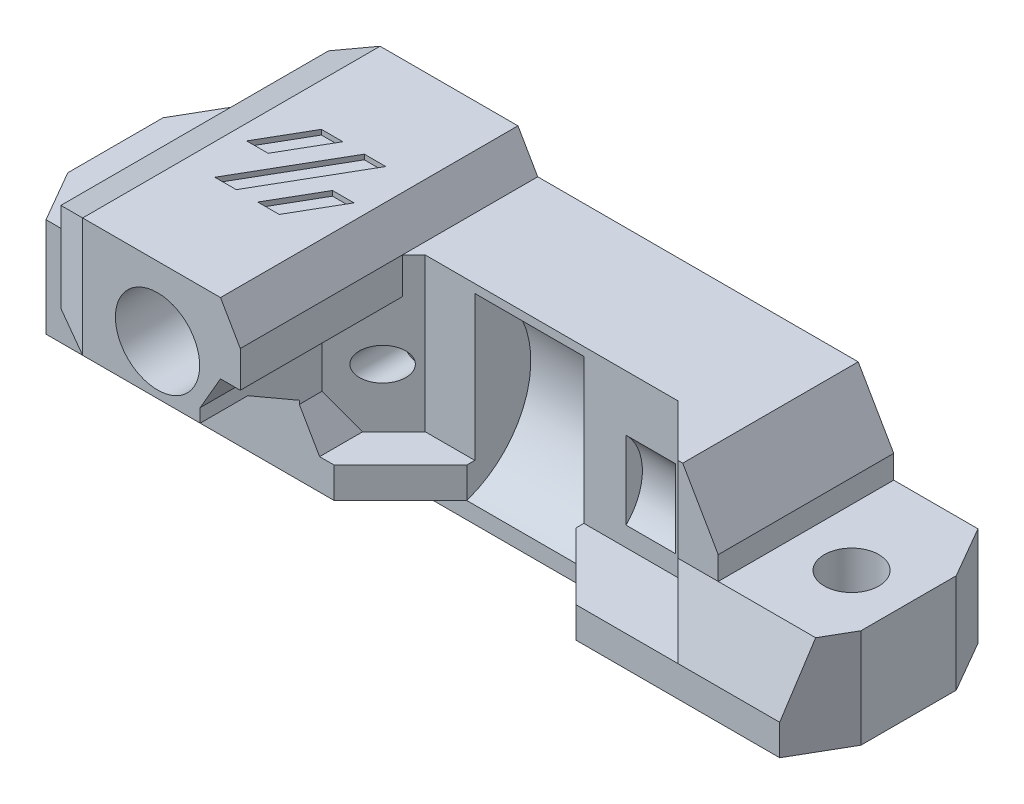
from build123d import *
from OCP.BRepFilletAPI import BRepFilletAPI_MakeChamfer

# Parameters (mm, degrees)
AUFSATZ_LINEAR_AUSTRAGEN1_DEPTH       = 80
SKIZZE2_R                             = 4.25
SCHNITT_LINEAR_AUSTRAGEN1_DEPTH       = 30
SKIZZE3_R                             = 1.65
SCHNITT_LINEAR_AUSTRAGEN2_DEPTH       = 17.5
SKIZZE4_R                             = 1.65
SCHNITT_LINEAR_AUSTRAGEN3_DEPTH       = 30
SCHNITT_LINEAR_START                  = -22
SKIZZE5_R                             = 2.75
SCHNITT_LINEAR_AUSTRAGEN4_DEPTH       = 22
SKIZZE6_R                             = 2.75
SCHNITT_LINEAR_AUSTRAGEN5_DEPTH       = 10
SCHNITT_LINEAR_AUSTRAGEN6_DEPTH       = 9.5
SCHNITT_LINEAR_START_2                = -12.5
SKIZZE8_W                             = 11.5
SKIZZE8_H                             = 12
SCHNITT_LINEAR_AUSTRAGEN7_DEPTH       = 30
SCHNITT_LINEAR_START_3                = 10.2
SKIZZE9_R                             = 9.5
SCHNITT_LINEAR_AUSTRAGEN8_DEPTH       = 11
SCHNITT_LINEAR_START_4                = 25.45
SKIZZE10_R                            = 5.5
SCHNITT_LINEAR_AUSTRAGEN9_DEPTH       = 5
AUFSATZ_LINEAR_START                  = -18.545259589
AUFSATZ_LINEAR_AUSTRAGEN2_DEPTH       = 15.445259589
SCHNITT_LINEAR_START_5                = -20.5
SKIZZE12_R                            = 1.65
SCHNITT_LINEAR_AUSTRAGEN10_DEPTH      = 20.5
FASE1_SIZE                            = 1.6
SKIZZE15_W                            = 20
SKIZZE15_H                            = 10
SCHNITT_LINEAR_AUSTRAGEN12_DEPTH      = 80
SCHNITT_LINEAR_START_6                = -15.44526
SCHNITT_LINEAR_AUSTRAGEN13_DEPTH      = 15.44526
SCHNITT_LINEAR_START_7                = -3.1
SKIZZE17_W                            = 49.404551733
SKIZZE17_H                            = 10
SCHNITT_LINEAR_AUSTRAGEN14_DEPTH      = 3.1
SCHNITT_LINEAR_AUSTRAGEN17_DEPTH      = 11
AUFSATZ_LINEAR_AUSTRAGEN3_REACH       = 87.346
SKIZZE21_W                            = 10
SKIZZE21_H                            = 10
SCHNITT_LINEAR_AUSTRAGEN18_DEPTH      = 30.595448267
SCHNITT_LINEAR_AUSTRAGEN19_REACH      = 76.674
SCHNITT_LINEAR_AUSTRAGEN19_END_RADIUS = 4.25
SKIZZE22_R                            = 2.25
SKIZZE23_R                            = 3
SCHNITT_LINEAR_AUSTRAGEN20_DEPTH      = 4
FASE2_SIZE                            = 3
FASE2_SIZE2                           = 5.196152423
AUFSATZ_LINEAR_START_2                = -17
AUFSATZ_LINEAR_AUSTRAGEN4_DEPTH       = 46
FASE3_SIZE                            = 3
FASE3_SIZE2                           = 5.196152423
FASE4_SIZE                            = 3
FASE4_SIZE2                           = 5.196152423
SCHNITT_LINEAR_AUSTRAGEN23_DEPTH      = 3.1
SCHNITT_LINEAR_AUSTRAGEN22_DEPTH      = 0.5
K_RPER_VERSCHIEBEN_KOPIEREN1_ANGLE    = 90


# Read off the part's stored shape, not the designer's step: Aufsatz-Linear austragen2, Schnitt-Linear austragen17
with BuildPart() as part:
    # Skizze1 → Aufsatz-Linear austragen1 (new body)
    with BuildSketch(Plane(origin=(0, 0, 0), x_dir=(0, 0, -1), z_dir=(1, 0, 0))):
        Polygon((0, 0), (0, 20), (-22, 20), (-22, -10), (20, -10), (20, 0), align=None)
    extrude(amount=AUFSATZ_LINEAR_AUSTRAGEN1_DEPTH)

    # Skizze2 → Schnitt-Linear austragen1 (cut)
    with BuildSketch(Plane(origin=(0, 20, 0), x_dir=(1, 0, 0), z_dir=(0, 1, 0))):
        with Locations(Location((55.75, -15, 0), (0, 0, 270))):
            Circle(SKIZZE2_R)
    extrude(amount=-SCHNITT_LINEAR_AUSTRAGEN1_DEPTH, mode=Mode.SUBTRACT)

    # Skizze3 → Schnitt-Linear austragen2 (cut)
    with BuildSketch(Plane.XZ.offset(10)):
        Polygon((49.399147039, 22), (47.404551733, 18.545259589), (47.404551733, 14.9), (49.404551733, 14.9), (51.45, 11.357179677), (51.45, 6.642820323), (49.404551733, 3.1), (17.595448267, 3.1), (15.55, 6.642820323), (15.55, 11.357179677), (17.595448267, 14.9), (19.595448267, 14.9), (19.595448267, 18.545259589), (0, 18.545259589), (0, 22), align=None)
        with Locations(Location((48.4, 9, 0), (0, 0, 270))):
            Circle(SKIZZE3_R, mode=Mode.SUBTRACT)
        with Locations(Location((18.6, 9, 0), (0, 0, 270))):
            Circle(SKIZZE3_R, mode=Mode.SUBTRACT)
    extrude(amount=-SCHNITT_LINEAR_AUSTRAGEN2_DEPTH, mode=Mode.SUBTRACT)

    # Skizze4 → Schnitt-Linear austragen3 (cut)
    with BuildSketch(Plane.XZ.offset(10)):
        with Locations(Location((18.6, 9, 0), (0, 0, 270))):
            Circle(SKIZZE4_R)
        with Locations(Location((48.4, 9, 0), (0, 0, 270))):
            Circle(SKIZZE4_R)
    extrude(amount=-SCHNITT_LINEAR_AUSTRAGEN3_DEPTH, mode=Mode.SUBTRACT)

    # Skizze5 → Schnitt-Linear austragen4 (cut)
    with BuildSketch(Plane(origin=(0, 0, 0), x_dir=(-1, 0, 0), z_dir=(0, 0, -1)).offset(SCHNITT_LINEAR_START)):
        with Locations((-5.75, 10)):
            Circle(SKIZZE5_R)
        with Locations((-74.25, 10)):
            Circle(SKIZZE5_R)
    extrude(amount=SCHNITT_LINEAR_AUSTRAGEN4_DEPTH, mode=Mode.SUBTRACT)

    # Skizze6 → Schnitt-Linear austragen5 (cut)
    with BuildSketch(Plane(origin=(0, 0, 0), x_dir=(1, 0, 0), z_dir=(0, 1, 0))):
        with Locations(Location((40, 10, 0), (0, 0, 270))):
            Circle(SKIZZE6_R)
    extrude(amount=-SCHNITT_LINEAR_AUSTRAGEN5_DEPTH, mode=Mode.SUBTRACT)

    # Skizze7 → Schnitt-Linear austragen6 (cut)
    with BuildSketch(Plane(origin=(0, 20, 0), x_dir=(1, 0, 0), z_dir=(0, 1, 0))):
        Polygon((21.890896534, -9), (20.245448267, -6.15), (16.954551733, -6.15), (15.309103466, -9), (16.954551733, -11.85), (20.245448267, -11.85), align=None)
        Polygon((51.690896534, -9), (50.045448267, -6.15), (46.754551733, -6.15), (45.109103466, -9), (46.754551733, -11.85), (50.045448267, -11.85), align=None)
    extrude(amount=-SCHNITT_LINEAR_AUSTRAGEN6_DEPTH, mode=Mode.SUBTRACT)

    # Skizze8 → Schnitt-Linear austragen7 (cut)
    with BuildSketch(Plane.XZ.offset(-7.5).offset(SCHNITT_LINEAR_START_2)):
        Polygon((49.399147039, 22), (47.404551733, 18.545259589), (15.081237719, 18.545259589), (11.5, 12.342373906), (11.5, 10), (0, 10), (0, 22), align=None)
        with Locations((74.25, 16)):
            Rectangle(SKIZZE8_W, SKIZZE8_H)
    extrude(amount=SCHNITT_LINEAR_AUSTRAGEN7_DEPTH, mode=Mode.SUBTRACT)

    # Skizze9 → Schnitt-Linear austragen8 (cut)
    with BuildSketch(Plane.ZY.offset(-51.45).offset(SCHNITT_LINEAR_START_3)):
        with Locations((9, 3.65)):
            Circle(SKIZZE9_R)
    extrude(amount=SCHNITT_LINEAR_AUSTRAGEN8_DEPTH, mode=Mode.SUBTRACT)

    # Skizze10 → Schnitt-Linear austragen9 (cut)
    with BuildSketch(Plane.ZY.offset(-51.45).offset(SCHNITT_LINEAR_START_4)):
        with Locations((9, 3.65)):
            Circle(SKIZZE10_R)
    extrude(amount=SCHNITT_LINEAR_AUSTRAGEN9_DEPTH, mode=Mode.SUBTRACT)

    # Aufsatz-Linear austragen2 outline → Aufsatz-Linear austragen2 (add)
    with BuildSketch(Plane(origin=(0, 0, 0), x_dir=(-1, 0, 0), z_dir=(0, 0, -1)).offset(AUFSATZ_LINEAR_START)):
        Polygon((-46.25, 7.5), (-51.45, 7.5), (-51.45, 2.3), align=None)
        Polygon((-15.55, 7.5), (-20.75, 7.5), (-15.55, 2.3), align=None)
    extrude(amount=AUFSATZ_LINEAR_AUSTRAGEN2_DEPTH)

    # Skizze12 → Schnitt-Linear austragen10 (cut)
    with BuildSketch(Plane(origin=(0, 10.5, 0), x_dir=(1, 0, 0), z_dir=(0, 1, 0)).offset(SCHNITT_LINEAR_START_5)):
        with Locations(Location((18.6, -9, 0), (0, 0, 90))):
            Circle(SKIZZE12_R)
        with Locations(Location((48.4, -9, 0), (0, 0, 90))):
            Circle(SKIZZE12_R)
    extrude(amount=SCHNITT_LINEAR_AUSTRAGEN10_DEPTH, mode=Mode.SUBTRACT)

    # Fase1
    # the kernel refuses this chamfer: 1.6 mm, written as the material it takes off along each edge
    with BuildSketch(Plane(origin=(18.6, 10.5, 9), x_dir=(0, 0, -1), z_dir=(-1, 0, 0))) as fase1_piece_1_section:
        Polygon((1.65 + FASE1_SIZE, 0), (1.65, FASE1_SIZE), (1.65, 0), align=None)
    fase1_piece_1 = revolve(axis=Axis((18.6, 10.5, 9), (0, -1, 0)), mode=Mode.PRIVATE)
    fase1_piece_1 = split(fase1_piece_1, bisect_by=Plane(origin=(20.016275588, 9.716390068, 12.246938724), z_dir=(-0.8660254037844389, 0, -0.4999999999999995)), keep=Keep.TOP, mode=Mode.PRIVATE)
    fase1_piece_1 = split(fase1_piece_1, bisect_by=Plane(origin=(18.6, 9.716390068, 11.85), z_dir=(0, 0, -1)), keep=Keep.TOP, mode=Mode.PRIVATE)
    fase1_piece_1 = split(fase1_piece_1, bisect_by=Plane(origin=(22.120069214, 9.716390068, 9.396938724), z_dir=(-0.8660254037844397, 0, 0.4999999999999981)), keep=Keep.TOP, mode=Mode.PRIVATE)
    fase1_piece_1 = split(fase1_piece_1, bisect_by=Plane(origin=(17.183724412, 9.716390068, 12.246938724), z_dir=(0.8660254037844387, 0, -0.4999999999999999)), keep=Keep.TOP, mode=Mode.PRIVATE)
    fase1_piece_1 = split(fase1_piece_1, bisect_by=Plane(origin=(18.6, 9.716390068, 6.15), z_dir=(0, 0, 1)), keep=Keep.TOP, mode=Mode.PRIVATE)
    fase1_piece_1 = split(fase1_piece_1, bisect_by=Plane(origin=(15.079930786, 9.716390068, 9.396938724), z_dir=(0.8660254037844385, 0, 0.5000000000000003)), keep=Keep.TOP, mode=Mode.PRIVATE)
    add(fase1_piece_1, mode=Mode.SUBTRACT)
    with BuildSketch(Plane(origin=(48.4, 10.5, 9), x_dir=(0, 0, -1), z_dir=(-1, 0, 0))) as fase1_piece_2_section:
        Polygon((1.65 + FASE1_SIZE, 0), (1.65, FASE1_SIZE), (1.65, 0), align=None)
    fase1_piece_2 = revolve(axis=Axis((48.4, 10.5, 9), (0, -1, 0)), mode=Mode.PRIVATE)
    fase1_piece_2 = split(fase1_piece_2, bisect_by=Plane(origin=(49.816275588, 9.716390068, 12.246938724), z_dir=(-0.8660254037844392, 0, -0.4999999999999991)), keep=Keep.TOP, mode=Mode.PRIVATE)
    fase1_piece_2 = split(fase1_piece_2, bisect_by=Plane(origin=(48.4, 9.716390068, 11.85), z_dir=(0, 0, -1)), keep=Keep.TOP, mode=Mode.PRIVATE)
    fase1_piece_2 = split(fase1_piece_2, bisect_by=Plane(origin=(51.920069214, 9.716390068, 9.396938724), z_dir=(-0.8660254037844392, 0, 0.49999999999999917)), keep=Keep.TOP, mode=Mode.PRIVATE)
    fase1_piece_2 = split(fase1_piece_2, bisect_by=Plane(origin=(46.983724412, 9.716390068, 12.246938724), z_dir=(0.8660254037844384, 0, -0.5000000000000006)), keep=Keep.TOP, mode=Mode.PRIVATE)
    fase1_piece_2 = split(fase1_piece_2, bisect_by=Plane(origin=(48.4, 9.716390068, 6.15), z_dir=(0, 0, 1)), keep=Keep.TOP, mode=Mode.PRIVATE)
    fase1_piece_2 = split(fase1_piece_2, bisect_by=Plane(origin=(44.879930786, 9.716390068, 9.396938724), z_dir=(0.8660254037844386, 0, 0.5000000000000001)), keep=Keep.TOP, mode=Mode.PRIVATE)
    add(fase1_piece_2, mode=Mode.SUBTRACT)

    # Skizze15 → Schnitt-Linear austragen12 (cut)
    with BuildSketch(Plane(origin=(80, 0, 0), x_dir=(0, 0, -1), z_dir=(1, 0, 0))):
        with Locations((10, -5)):
            Rectangle(SKIZZE15_W, SKIZZE15_H)
    extrude(amount=-SCHNITT_LINEAR_AUSTRAGEN12_DEPTH, mode=Mode.SUBTRACT)

    # Skizze16 → Schnitt-Linear austragen13 (cut)
    with BuildSketch(Plane.XY.offset(18.545259589).offset(SCHNITT_LINEAR_START_6)):
        Polygon((0, -10), (0, 2.3), (15.55, 2.3), (19.595448267, 6.345448267), (19.595448267, -10), align=None)
    extrude(amount=SCHNITT_LINEAR_AUSTRAGEN13_DEPTH, mode=Mode.SUBTRACT)

    # Skizze17 → Schnitt-Linear austragen14 (cut)
    with BuildSketch(Plane.XY.offset(3.1).offset(SCHNITT_LINEAR_START_7)):
        with Locations((24.702275867, -5)):
            Rectangle(SKIZZE17_W, SKIZZE17_H)
    extrude(amount=SCHNITT_LINEAR_AUSTRAGEN14_DEPTH, mode=Mode.SUBTRACT)

    # Schnitt-Linear austragen17 outline → Schnitt-Linear austragen17 (cut)
    with BuildSketch(Plane(origin=(30.25, 0, 0), x_dir=(0, 0, -1), z_dir=(1, 0, 0))):
        with BuildLine():
            ThreePointArc((0, 0.608618735), (-0.109374334, 0.302347799), (-0.229167656, 0))
            Line((-0.229167656, 0), (0, 0))
            Line((0, 0), (0, 0.608618735))
        make_face()
    extrude(amount=SCHNITT_LINEAR_AUSTRAGEN17_DEPTH, mode=Mode.SUBTRACT)

    # Aufsatz-Linear austragen3: up to this plane
    aufsatz_linear_austragen3_end = Plane(origin=(-0.5159461, -13.7659461, 25.899170114), z_dir=(0.707106781186543, -0.707106781186552, 0))
    # Skizze20 → Aufsatz-Linear austragen3 (add, up to the surface)
    with BuildSketch(Plane.ZY, mode=Mode.PRIVATE) as aufsatz_linear_austragen3_sk1:
        Polygon((10, 2.3), (3.1, 2.3), (3.1, 0), align=None)
    aufsatz_linear_austragen3_tool1 = split(extrude(aufsatz_linear_austragen3_sk1.sketch, amount=-AUFSATZ_LINEAR_AUSTRAGEN3_REACH, mode=Mode.PRIVATE), bisect_by=aufsatz_linear_austragen3_end, keep=Keep.BOTH, mode=Mode.PRIVATE)
    add(aufsatz_linear_austragen3_tool1.solids().sort_by_distance((0, 1.533333, 5.4))[0])

    # Skizze21 → Schnitt-Linear austragen18 (cut)
    with BuildSketch(Plane(origin=(80, 0, 0), x_dir=(0, 0, -1), z_dir=(1, 0, 0))):
        with Locations((-5, -5)):
            Rectangle(SKIZZE21_W, SKIZZE21_H)
    extrude(amount=-SCHNITT_LINEAR_AUSTRAGEN18_DEPTH, mode=Mode.SUBTRACT)

    # Schnitt-Linear austragen19: up to this cylinder (the profile starts outside it)
    schnitt_linear_austragen19_end = Plane(origin=(55.75, -2, 15), z_dir=(0, 1, 0)) * Cylinder(SCHNITT_LINEAR_AUSTRAGEN19_END_RADIUS, 162.848, mode=Mode.PRIVATE)
    # Skizze22 → Schnitt-Linear austragen19 (cut, up to the surface)
    with BuildSketch(Plane(origin=(68.5, 0, 0), x_dir=(0, 0, -1), z_dir=(1, 0, 0)), mode=Mode.PRIVATE) as schnitt_linear_austragen19_sk1:
        with Locations((-15, -2)):
            Circle(SKIZZE22_R)
    schnitt_linear_austragen19_tool1 = extrude(schnitt_linear_austragen19_sk1.sketch, amount=-SCHNITT_LINEAR_AUSTRAGEN19_REACH, mode=Mode.PRIVATE) - schnitt_linear_austragen19_end
    add(schnitt_linear_austragen19_tool1.solids().sort_by_distance((68.5, -2, 15))[0], mode=Mode.SUBTRACT)

    # Skizze23 → Schnitt-Linear austragen20 (cut)
    with BuildSketch(Plane(origin=(68.5, 0, 0), x_dir=(0, 0, -1), z_dir=(1, 0, 0))):
        with Locations((-15, -2)):
            Circle(SKIZZE23_R)
    extrude(amount=-SCHNITT_LINEAR_AUSTRAGEN20_DEPTH, mode=Mode.SUBTRACT)

    # Fase2
    fase2_edges = [part.edges().sort_by_distance(p)[0] for p in [
        (68.5, 5, 22),
    ]]
    fase2_side = [part.faces().sort_by_distance(p)[0] for p in [
        (68.5, 5.5966386, 16.085234086),
    ]]
    chamfer(fase2_edges, length=FASE2_SIZE, length2=FASE2_SIZE2, reference=fase2_side[0])

    # Skizze24 → Aufsatz-Linear austragen4 (add)
    with BuildSketch(Plane(origin=(80, 0, 0), x_dir=(0, 0, -1), z_dir=(1, 0, 0)).offset(AUFSATZ_LINEAR_START_2)):
        Polygon((2, 11), (0, 13), (0, 7), (2, 7), align=None)
    extrude(amount=-AUFSATZ_LINEAR_AUSTRAGEN4_DEPTH)

    # Fase3: one chamfer whose edges measure the first distance from different faces: ONE call of the kernel's chamfer builder (chamfer() names one face for all edges)
    fase3_edges_1 = [part.edges().sort_by_distance(p)[0] for p in [
        (80, 20, 5),
        (0, 20, 5),
    ]]
    fase3_side_1 = [part.faces().sort_by_distance(p)[0] for p in [
        (40.691863388, 20, 8.699373831),
    ]]
    fase3_edges_2 = [part.edges().sort_by_distance(p)[0] for p in [
        (68.5, -10, 14.5),
    ]]
    fase3_side_2 = [part.faces().sort_by_distance(p)[0] for p in [
        (68.5, 5.818780812, 14.441515656),
    ]]
    fase3_edges_3 = [part.edges().sort_by_distance(p)[0] for p in [
        (0, 0, 1.549999795),
    ]]
    fase3_side_3 = [part.faces().sort_by_distance(p)[0] for p in [
        (15.125, 0, 1.55),
    ]]
    fase3_edges_4 = [part.edges().sort_by_distance(p)[0] for p in [
        (80, 0, 5),
    ]]
    fase3_side_4 = [part.faces().sort_by_distance(p)[0] for p in [
        (63.645982635, 0, 4.651763949),
    ]]
    fase3 = BRepFilletAPI_MakeChamfer(part.part.solid().wrapped)
    for e in fase3_edges_1:
        fase3.Add(FASE3_SIZE, FASE3_SIZE2, e.wrapped, fase3_side_1[0].wrapped)  # the first distance lies on this face
    for e in fase3_edges_2:
        fase3.Add(FASE3_SIZE, FASE3_SIZE2, e.wrapped, fase3_side_2[0].wrapped)  # the first distance lies on this face
    for e in fase3_edges_3:
        fase3.Add(FASE3_SIZE, FASE3_SIZE2, e.wrapped, fase3_side_3[0].wrapped)  # the first distance lies on this face
    for e in fase3_edges_4:
        fase3.Add(FASE3_SIZE, FASE3_SIZE2, e.wrapped, fase3_side_4[0].wrapped)  # the first distance lies on this face
    add(Compound.cast(fase3.Shape()), mode=Mode.REPLACE)

    # Fase4
    fase4_edges = [part.edges().sort_by_distance(p)[0] for p in [
        (59.975, 0, 10),
    ]]
    fase4_side = [part.faces().sort_by_distance(p)[0] for p in [
        (62.113288749, 0, 4.615831632),
    ]]
    chamfer(fase4_edges, length=FASE4_SIZE, length2=FASE4_SIZE2, reference=fase4_side[0])

    # Skizze28 → Schnitt-Linear austragen23 (cut)
    with BuildSketch(Plane(origin=(0, 0, 0), x_dir=(-1, 0, 0), z_dir=(0, 0, -1))):
        Polygon((-30.25, 6.691381265), (-23.558618735, 0), (-47.941381265, 0), (-41.25, 6.691381265), align=None)
    extrude(amount=-SCHNITT_LINEAR_AUSTRAGEN23_DEPTH, mode=Mode.SUBTRACT)


with BuildPart() as body_2:
    # Spiegeln1: mirrored copy
    add(part.part.mirror(Plane(origin=(80, 0, -20), x_dir=(0, 0, 1), z_dir=(1, 0, 0))))

    # Skizze27 → Schnitt-Linear austragen22 (cut)
    with BuildSketch(Plane.XY.offset(22)):
        Polygon((105.325778558, 9.780127019), (107.490842068, 9.780127019), (101.971226825, 0.219872981), (99.806163316, 0.219872981), align=None)
        Polygon((100.995651539, 9.780127019), (103.160715049, 9.780127019), (100.400907428, 5), (98.235843918, 5), align=None)
        Polygon((106.896097956, 5), (104.136290335, 0.219872981), (106.301353844, 0.219872981), (109.061161466, 5), align=None)
    extrude(amount=-SCHNITT_LINEAR_AUSTRAGEN22_DEPTH, mode=Mode.SUBTRACT)


with BuildPart() as body_2_1:
    # Körper-Verschieben/Kopieren1: moved
    add(body_2.part.rotate(Axis((0, 5, 10), (-1, 0, 0)), K_RPER_VERSCHIEBEN_KOPIEREN1_ANGLE))


solid = body_2_1.part
